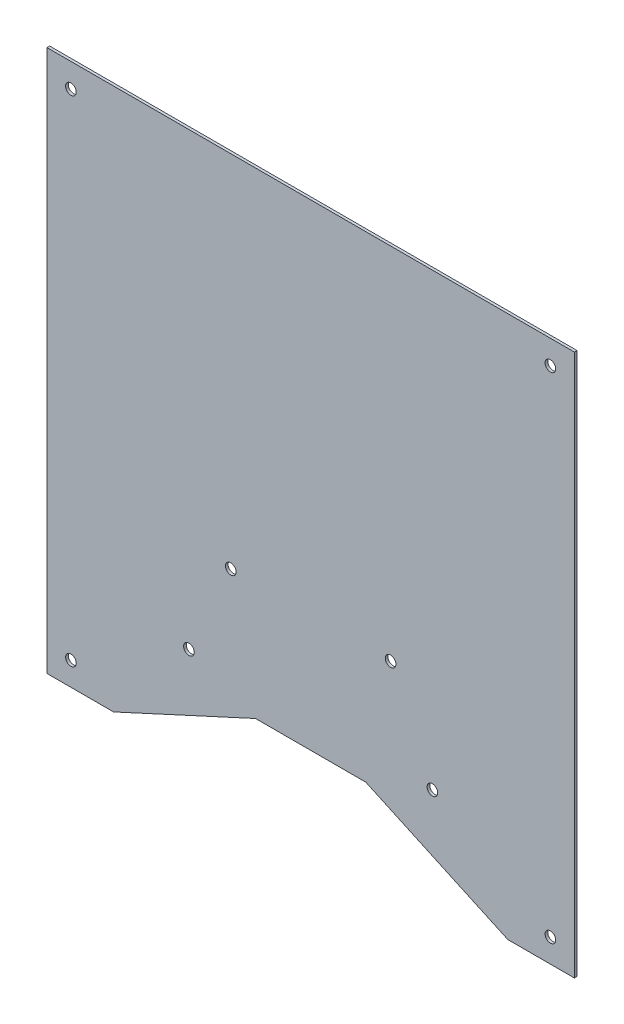
from build123d import *

# Parameters (mm, degrees)
ESQUISSE2_W               = 198
ESQUISSE2_H               = 1
T_LE_DE_BASE_PLI_E1_DEPTH = 203.5
ESQUISSE7_R               = 2
ENL_V_MAT_EXTRU_1_DEPTH   = 227.305656138
ENL_V_MAT_EXTRU_2_DEPTH   = 227.305656138


# Sheet-metal steps are written as plain solids
with BuildPart() as part:
    # Esquisse2 → Tôle de base pliée1 (new body)
    with BuildSketch(Plane(origin=(0, 0, 0), x_dir=(1, 0, 0), z_dir=(0, 1, 0))):
        with Locations((0, -0.5)):
            Rectangle(ESQUISSE2_W, ESQUISSE2_H)
    extrude(amount=T_LE_DE_BASE_PLI_E1_DEPTH)

    # Esquisse7 → Enlèv. mat.-Extru.1 (cut, through all)
    with BuildSketch(Plane.XY.offset(1)):
        with Locations((-90, 194.5)):
            Circle(ESQUISSE7_R)
        with Locations((90, 194.5)):
            Circle(ESQUISSE7_R)
        with Locations((-90, 8.82)):
            Circle(ESQUISSE7_R)
        with Locations((90, 8.82)):
            Circle(ESQUISSE7_R)
        with Locations((-45.7, 34.51)):
            Circle(ESQUISSE7_R)
        with Locations((45.7, 34.51)):
            Circle(ESQUISSE7_R)
        with Locations((-30, 68.5)):
            Circle(ESQUISSE7_R)
        with Locations(Location((30, 68.5, 0), (0, 0, 180))):
            Circle(ESQUISSE7_R)
    extrude(amount=-ENL_V_MAT_EXTRU_1_DEPTH, mode=Mode.SUBTRACT)

    # Esquisse10 → Enlèv. mat.-Extru.2 (cut, through all)
    with BuildSketch(Plane.XY.offset(1)):
        Polygon((-74, 0), (-20.7, 24.51), (20.7, 24.51), (74, 0), align=None)
    extrude(amount=-ENL_V_MAT_EXTRU_2_DEPTH, mode=Mode.SUBTRACT)


solid = part.part
